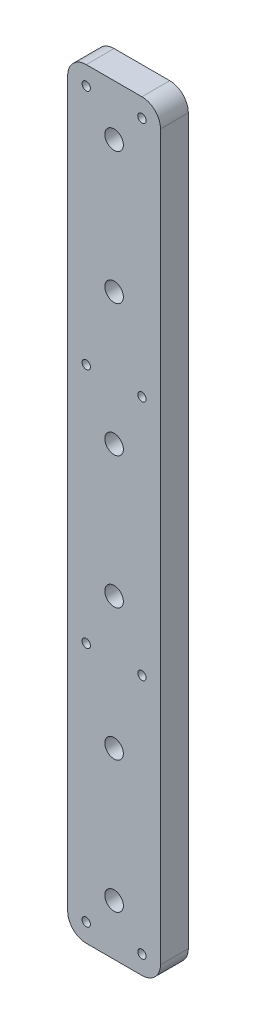
from build123d import *

# Parameters (mm, degrees)
ESQUISSE1_W                  = 50
ESQUISSE1_H                  = 410
BOSS_EXTRU_1_DEPTH           = 15
ENL_V_MAT_EXTRU_1_DEPTH      = 414.309811159
ENL_V_MAT_EXTRU_1_DEPTH_BACK = 414.309811159
ESQUISSE2_R                  = 5
ESQUISSE2_R_2                = 2.25
CONG_1_R                     = 10


with BuildPart() as part:
    # Esquisse1 → Boss.-Extru.1 (new body)
    with BuildSketch(Plane.XY):
        with Locations((25, 205)):
            Rectangle(ESQUISSE1_W, ESQUISSE1_H)
    extrude(amount=BOSS_EXTRU_1_DEPTH)

    # Esquisse2 → Enlèv. mat.-Extru.1 (cut, two sides: drawn at the far end of the back side and taken through both)
    with BuildSketch(Plane.XY.offset(15).offset(-ENL_V_MAT_EXTRU_1_DEPTH_BACK)):
        with Locations((25, 240.5)):
            Circle(ESQUISSE2_R)
        with Locations((25, 311.5)):
            Circle(ESQUISSE2_R)
        with Locations((25, 382.5)):
            Circle(ESQUISSE2_R)
        with Locations((25, 27.5)):
            Circle(ESQUISSE2_R)
        with Locations((25, 98.5)):
            Circle(ESQUISSE2_R)
        with Locations((25, 169.5)):
            Circle(ESQUISSE2_R)
        with Locations((40, 270)):
            Circle(ESQUISSE2_R_2)
        with Locations((40, 400)):
            Circle(ESQUISSE2_R_2)
        with Locations((40, 10)):
            Circle(ESQUISSE2_R_2)
        with Locations((40, 140)):
            Circle(ESQUISSE2_R_2)
        with Locations((10, 140)):
            Circle(ESQUISSE2_R_2)
        with Locations((10, 10)):
            Circle(ESQUISSE2_R_2)
        with Locations((10, 400)):
            Circle(ESQUISSE2_R_2)
        with Locations((10, 270)):
            Circle(ESQUISSE2_R_2)
    extrude(amount=ENL_V_MAT_EXTRU_1_DEPTH + ENL_V_MAT_EXTRU_1_DEPTH_BACK, mode=Mode.SUBTRACT)

    # Congé1
    cong_1_edges = [part.edges().sort_by_distance(p)[0] for p in [
        (50, 0, 7.5),
        (0, 0, 7.5),
        (50, 410, 7.5),
        (0, 410, 7.5),
    ]]
    fillet(cong_1_edges, radius=CONG_1_R)


solid = part.part
